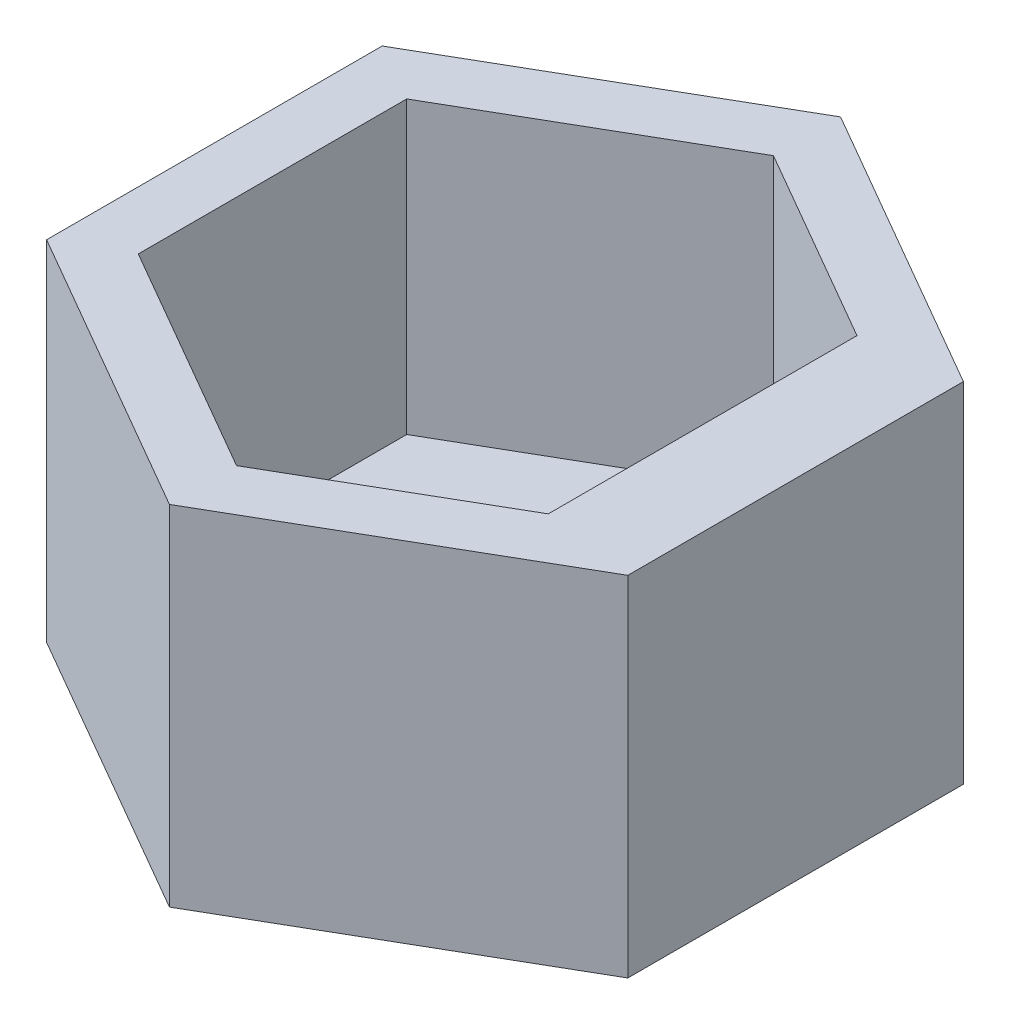
from build123d import *

# Parameters (mm, degrees)
EXTRUDE_1_DEPTH = 30
SHELL_START     = 5
SHELL_1_DEPTH   = 25


# Read off the part's stored shape, not the designer's step: 薄殼1
with BuildPart() as part:
    # 草圖1 → 伸長1 (new body)
    with BuildSketch(Plane(origin=(0, 0, 0), x_dir=(1, 0, 0), z_dir=(0, 1, 0))):
        Polygon((0, 28.867513459), (-25, 14.43375673), (-25, -14.43375673), (0, -28.867513459), (25, -14.43375673), (25, 14.43375673), align=None)
    extrude(amount=EXTRUDE_1_DEPTH)

    # 薄殼1 outline → 薄殼1 (cut)
    with BuildSketch(Plane(origin=(0, 0, 0), x_dir=(1, 0, 0), z_dir=(0, 1, 0)).offset(SHELL_START)):
        Polygon((17, 13.279056191), (0, 23.094010768), (-20, 11.547005384), (-20, -11.547005384), (0, -23.094010768), (17, -13.279056191), align=None)
    extrude(amount=SHELL_1_DEPTH, mode=Mode.SUBTRACT)


solid = part.part
